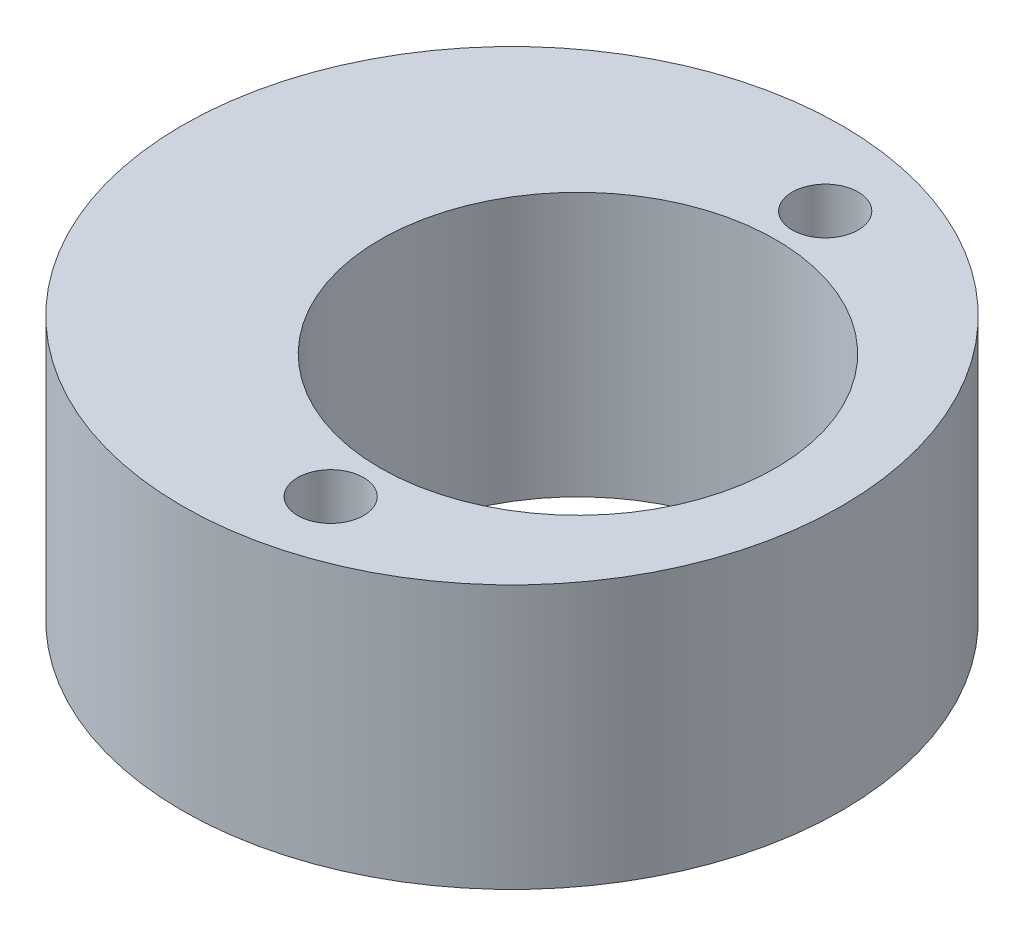
from build123d import *

# Parameters (mm, degrees)
SKETCH1_R           = 5
SKETCH1_R_2         = 3
BOSS_EXTRUDE1_DEPTH = 4
SKETCH2_R           = 0.5
CUT_EXTRUDE1_DEPTH  = 9.774964387


with BuildPart() as part:
    # Sketch1 → Boss-Extrude1 (new body)
    with BuildSketch(Plane(origin=(0, 0, 0), x_dir=(1, 0, 0), z_dir=(0, 1, 0))):
        with Locations((-1, 0)):
            Circle(SKETCH1_R)
        Circle(SKETCH1_R_2, mode=Mode.SUBTRACT)
    extrude(amount=BOSS_EXTRUDE1_DEPTH)

    # Sketch2 → Cut-Extrude1 (cut, through all)
    with BuildSketch(Plane(origin=(0, 4, 0), x_dir=(1, 0, 0), z_dir=(0, 1, 0))):
        with Locations((0, 3.75)):
            Circle(SKETCH2_R)
        with Locations((0, -3.75)):
            Circle(SKETCH2_R)
    extrude(amount=-CUT_EXTRUDE1_DEPTH, mode=Mode.SUBTRACT)


solid = part.part
